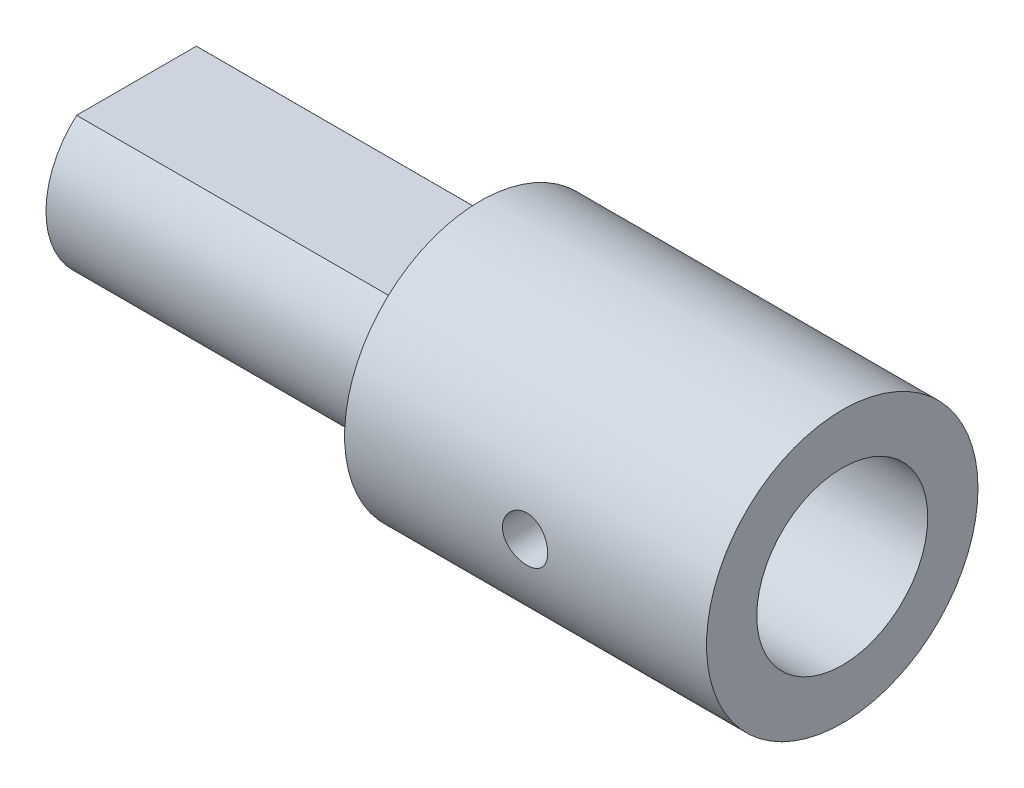
from build123d import *

# Parameters (mm, degrees)
SKETCH1_R               = 4.7625
BOSS_EXTRUDE1_DEPTH     = 12.7
SKETCH2_R               = 2.999994
CUT_EXTRUDE1_DEPTH      = 9.541256
SKETCH3_R               = 3.175
BOSS_EXTRUDE2_DEPTH     = 12.065
CUT_EXTRUDE2_DEPTH      = 7.62
CUT_EXTRUDE2_DEPTH_BACK = 7.62
SKETCH4_R               = 0.79375
SKETCH7_W               = 0.79375
SKETCH7_H               = 4.200130206
CUT_EXTRUDE3_DEPTH      = 12.065


with BuildPart() as part:
    # Sketch1 → Boss-Extrude1 (new body)
    with BuildSketch(Plane.YZ):
        Circle(SKETCH1_R)
    extrude(amount=BOSS_EXTRUDE1_DEPTH)

    # Sketch2 → Cut-Extrude1 (cut)
    with BuildSketch(Plane.YZ.offset(12.7)):
        Circle(SKETCH2_R)
    extrude(amount=-CUT_EXTRUDE1_DEPTH, mode=Mode.SUBTRACT)

    # Sketch3 → Boss-Extrude2 (add)
    with BuildSketch(Plane(origin=(0, 0, 0), x_dir=(0, -1, 0), z_dir=(-1, 0, 0))):
        Circle(SKETCH3_R)
    extrude(amount=BOSS_EXTRUDE2_DEPTH)

    # Sketch4 → Cut-Extrude2 (cut, two sides: drawn at the far end of the back side and taken through both)
    with BuildSketch(Plane(origin=(0, 0, 0), x_dir=(0, 1, 0), z_dir=(0, 0, 1)).offset(-CUT_EXTRUDE2_DEPTH_BACK)):
        with Locations((0, -6.333744)):
            Circle(SKETCH4_R)
    extrude(amount=CUT_EXTRUDE2_DEPTH + CUT_EXTRUDE2_DEPTH_BACK, mode=Mode.SUBTRACT)

    # Sketch7 → Cut-Extrude3 (cut)
    with BuildSketch(Plane(origin=(-12.065, 0, 0), x_dir=(0, -1, 0), z_dir=(-1, 0, 0))):
        with Locations((-2.778125, 0)):
            Rectangle(SKETCH7_W, SKETCH7_H)
    extrude(amount=-CUT_EXTRUDE3_DEPTH, mode=Mode.SUBTRACT)


solid = part.part
